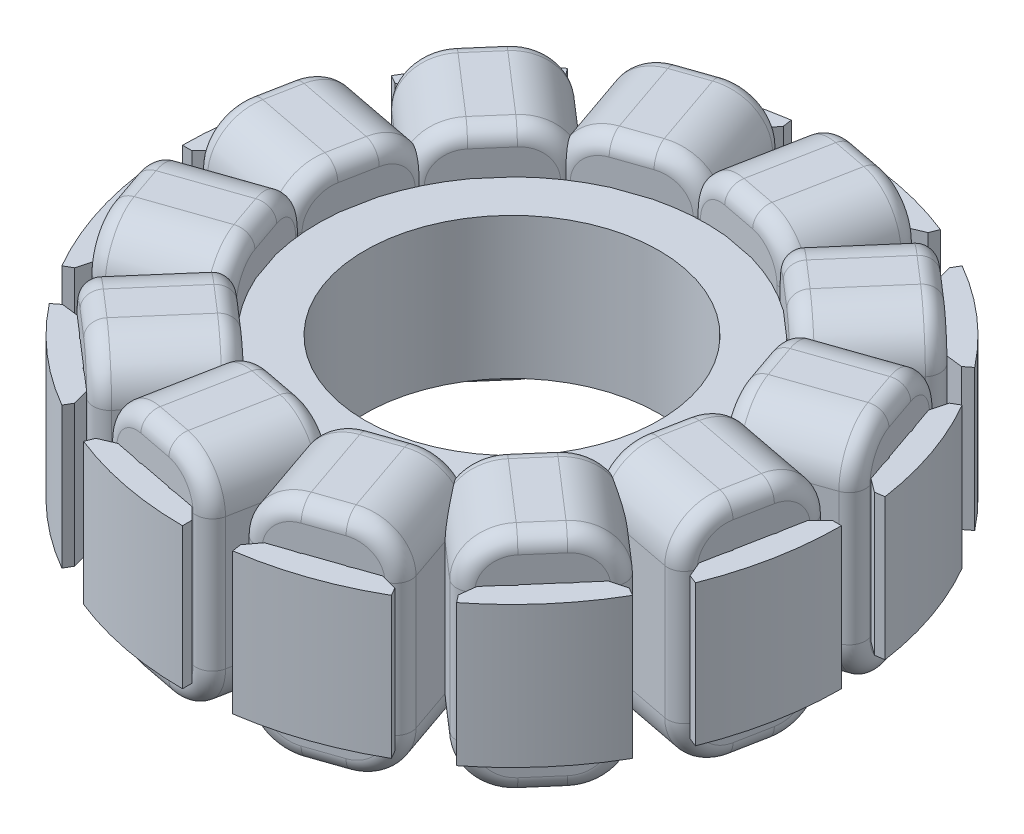
from build123d import *

# Parameters (mm, degrees)
SKETCH_1_R               = 6.25
EXTRUDE_1_DEPTH          = 6
CHAMFER_1_SIZE           = 0.6
EXTRUDE_2_DEPTH          = 7.8
EXTRUDE_2_DEPTH_BACK     = 1.8
FILLET_1_R               = 2
FILLET_2_R               = 0.7
PATTERN_CIRCULAR_1_COUNT = 12


with BuildPart() as part:
    # Эскиз1 → Бобышка-Вытянуть1 (new body)
    with BuildSketch(Plane(origin=(0, 0, 0), x_dir=(1, 0, 0), z_dir=(0, 1, 0))):
        with BuildLine():
            Line((0.818857221, 8.209261407), (1.720422101, 12.885656669))
            ThreePointArc((1.720422101, 12.885656669), (0.862108839, 12.971382669), (0, 13))
            Line((0, 13), (0, 14))
            ThreePointArc((0, 14), (2.65, 13.746908743), (5.204186881, 12.996785714))
            Line((5.204186881, 12.996785714), (4.832459247, 12.068443878))
            ThreePointArc((4.832459247, 12.068443878), (4.021727515, 12.362269525), (3.193299718, 12.601699763))
            Line((3.193299718, 12.601699763), (2.291734839, 7.925304501))
            ThreePointArc((2.291734839, 7.925304501), (3.605195483, 7.420583907), (4.813781859, 6.700000314))
            Line((4.813781859, 6.700000314), (7.932757579, 10.299094969))
            ThreePointArc((7.932757579, 10.299094969), (7.23229949, 10.802492494), (6.5, 11.258330249))
            Line((6.5, 11.258330249), (7, 12.124355653))
            ThreePointArc((7, 12.124355653), (9.168421692, 10.580172195), (11.005350903, 8.653453155))
            Line((11.005350903, 8.653453155), (10.219254409, 8.035349359))
            ThreePointArc((10.219254409, 8.035349359), (9.664052957, 8.695175699), (9.066328559, 9.316742266))
            Line((9.066328559, 9.316742266), (5.947352839, 5.717647611))
            ThreePointArc((5.947352839, 5.717647611), (6.832482828, 4.623816433), (7.518857536, 3.395479548))
            Line((7.518857536, 3.395479548), (12.01951707, 4.95289909))
            ThreePointArc((12.01951707, 4.95289909), (11.664601333, 5.739083179), (11.258330249, 6.5))
            Line((11.258330249, 6.5), (12.124355653, 7))
            ThreePointArc((12.124355653, 7), (13.230172195, 4.578487052), (13.857640037, 1.991434812))
            Line((13.857640037, 1.991434812), (12.867808606, 1.849189468))
            ThreePointArc((12.867808606, 1.849189468), (12.716903214, 2.698216568), (12.510041984, 3.535371204))
            Line((12.510041984, 3.535371204), (8.00938245, 1.977951661))
            ThreePointArc((8.00938245, 1.977951661), (8.229011916, 0.588101079), (8.209261407, -0.818857221))
            Line((8.209261407, -0.818857221), (12.885656669, -1.720422101))
            ThreePointArc((12.885656669, -1.720422101), (12.971382669, -0.862108839), (13, 0))
            Line((13, 0), (14, 0))
            ThreePointArc((14, 0), (13.746908743, -2.65), (12.996785714, -5.204186881))
            Line((12.996785714, -5.204186881), (12.068443878, -4.832459247))
            ThreePointArc((12.068443878, -4.832459247), (12.362269525, -4.021727515), (12.601699763, -3.193299718))
            Line((12.601699763, -3.193299718), (7.925304501, -2.291734839))
            ThreePointArc((7.925304501, -2.291734839), (7.420583907, -3.605195483), (6.700000314, -4.813781859))
            Line((6.700000314, -4.813781859), (10.299094969, -7.932757579))
            ThreePointArc((10.299094969, -7.932757579), (10.802492494, -7.23229949), (11.258330249, -6.5))
            Line((11.258330249, -6.5), (12.124355653, -7))
            ThreePointArc((12.124355653, -7), (10.580172195, -9.168421692), (8.653453155, -11.005350903))
            Line((8.653453155, -11.005350903), (8.035349359, -10.219254409))
            ThreePointArc((8.035349359, -10.219254409), (8.695175699, -9.664052957), (9.316742266, -9.066328559))
            Line((9.316742266, -9.066328559), (5.717647611, -5.947352839))
            ThreePointArc((5.717647611, -5.947352839), (4.623816433, -6.832482828), (3.395479548, -7.518857536))
            Line((3.395479548, -7.518857536), (4.95289909, -12.01951707))
            ThreePointArc((4.95289909, -12.01951707), (5.739083179, -11.664601333), (6.5, -11.258330249))
            Line((6.5, -11.258330249), (7, -12.124355653))
            ThreePointArc((7, -12.124355653), (4.578487052, -13.230172195), (1.991434812, -13.857640037))
            Line((1.991434812, -13.857640037), (1.849189468, -12.867808606))
            ThreePointArc((1.849189468, -12.867808606), (2.698216568, -12.716903214), (3.535371204, -12.510041984))
            Line((3.535371204, -12.510041984), (1.977951661, -8.00938245))
            ThreePointArc((1.977951661, -8.00938245), (0.588101079, -8.229011916), (-0.818857221, -8.209261407))
            Line((-0.818857221, -8.209261407), (-1.720422101, -12.885656669))
            ThreePointArc((-1.720422101, -12.885656669), (-0.862108839, -12.971382669), (0, -13))
            Line((0, -13), (0, -14))
            ThreePointArc((0, -14), (-2.65, -13.746908743), (-5.204186881, -12.996785714))
            Line((-5.204186881, -12.996785714), (-4.832459247, -12.068443878))
            ThreePointArc((-4.832459247, -12.068443878), (-4.021727515, -12.362269525), (-3.193299718, -12.601699763))
            Line((-3.193299718, -12.601699763), (-2.291734839, -7.925304501))
            ThreePointArc((-2.291734839, -7.925304501), (-3.605195483, -7.420583907), (-4.813781859, -6.700000314))
            Line((-4.813781859, -6.700000314), (-7.932757579, -10.299094969))
            ThreePointArc((-7.932757579, -10.299094969), (-7.23229949, -10.802492494), (-6.5, -11.258330249))
            Line((-6.5, -11.258330249), (-7, -12.124355653))
            ThreePointArc((-7, -12.124355653), (-9.168421692, -10.580172195), (-11.005350903, -8.653453155))
            Line((-11.005350903, -8.653453155), (-10.219254409, -8.035349359))
            ThreePointArc((-10.219254409, -8.035349359), (-9.664052957, -8.695175699), (-9.066328559, -9.316742266))
            Line((-9.066328559, -9.316742266), (-5.947352839, -5.717647611))
            ThreePointArc((-5.947352839, -5.717647611), (-6.832482828, -4.623816433), (-7.518857536, -3.395479548))
            Line((-7.518857536, -3.395479548), (-12.01951707, -4.95289909))
            ThreePointArc((-12.01951707, -4.95289909), (-11.664601333, -5.739083179), (-11.258330249, -6.5))
            Line((-11.258330249, -6.5), (-12.124355653, -7))
            ThreePointArc((-12.124355653, -7), (-13.230172195, -4.578487052), (-13.857640037, -1.991434812))
            Line((-13.857640037, -1.991434812), (-12.867808606, -1.849189468))
            ThreePointArc((-12.867808606, -1.849189468), (-12.716903214, -2.698216568), (-12.510041984, -3.535371204))
            Line((-12.510041984, -3.535371204), (-8.00938245, -1.977951661))
            ThreePointArc((-8.00938245, -1.977951661), (-8.229011916, -0.588101079), (-8.209261407, 0.818857221))
            Line((-8.209261407, 0.818857221), (-12.885656669, 1.720422101))
            ThreePointArc((-12.885656669, 1.720422101), (-12.971382669, 0.862108839), (-13, 0))
            Line((-13, 0), (-14, 0))
            ThreePointArc((-14, 0), (-13.746908743, 2.65), (-12.996785714, 5.204186881))
            Line((-12.996785714, 5.204186881), (-12.068443878, 4.832459247))
            ThreePointArc((-12.068443878, 4.832459247), (-12.362269525, 4.021727515), (-12.601699763, 3.193299718))
            Line((-12.601699763, 3.193299718), (-7.925304501, 2.291734839))
            ThreePointArc((-7.925304501, 2.291734839), (-7.420583907, 3.605195483), (-6.700000314, 4.813781859))
            Line((-6.700000314, 4.813781859), (-10.299094969, 7.932757579))
            ThreePointArc((-10.299094969, 7.932757579), (-10.802492494, 7.23229949), (-11.258330249, 6.5))
            Line((-11.258330249, 6.5), (-12.124355653, 7))
            ThreePointArc((-12.124355653, 7), (-10.580172195, 9.168421692), (-8.653453155, 11.005350903))
            Line((-8.653453155, 11.005350903), (-8.035349359, 10.219254409))
            ThreePointArc((-8.035349359, 10.219254409), (-8.695175699, 9.664052957), (-9.316742266, 9.066328559))
            Line((-9.316742266, 9.066328559), (-5.717647611, 5.947352839))
            ThreePointArc((-5.717647611, 5.947352839), (-4.623816433, 6.832482828), (-3.395479548, 7.518857536))
            Line((-3.395479548, 7.518857536), (-4.95289909, 12.01951707))
            ThreePointArc((-4.95289909, 12.01951707), (-5.739083179, 11.664601333), (-6.5, 11.258330249))
            Line((-6.5, 11.258330249), (-7, 12.124355653))
            ThreePointArc((-7, 12.124355653), (-4.578487052, 13.230172195), (-1.991434812, 13.857640037))
            Line((-1.991434812, 13.857640037), (-1.849189468, 12.867808606))
            ThreePointArc((-1.849189468, 12.867808606), (-2.698216568, 12.716903214), (-3.535371204, 12.510041984))
            Line((-3.535371204, 12.510041984), (-1.977951661, 8.00938245))
            ThreePointArc((-1.977951661, 8.00938245), (-0.588101079, 8.229011916), (0.818857221, 8.209261407))
        make_face()
        with Locations(Location((0, 0, 0), (0, 0, 270))):
            Circle(SKETCH_1_R, mode=Mode.SUBTRACT)
    extrude(amount=EXTRUDE_1_DEPTH)

    # Фаска1
    # the kernel refuses this chamfer: 0.6 mm, written as the material it takes off along each edge
    with BuildSketch(Plane(origin=(4.832459247, -1.580722619, -12.068443878), x_dir=(0.3717276343884804, 0, -0.9283418367346934), z_dir=(0, 1, 0)), Plane(origin=(10.219254409, -1.580722619, -8.035349359), x_dir=(0.7860964930364651, 0, -0.6181037968139096), z_dir=(0, 1, 0)), Plane(origin=(12.867808606, -1.580722619, -1.849189468), x_dir=(0.9898314312023908, 0, -0.14224534369822772), z_dir=(0, 1, 0)), Plane(origin=(12.068443878, -1.580722619, 4.832459247), x_dir=(0.9283418367346925, 0, 0.371727634388483), z_dir=(0, 1, 0)), Plane(origin=(8.035349359, -1.580722619, 10.219254409), x_dir=(0.6181037968139109, 0, 0.7860964930364639), z_dir=(0, 1, 0)), Plane(origin=(1.849189468, -1.580722619, 12.867808606), x_dir=(0.14224534369822298, 0, 0.9898314312023914), z_dir=(0, 1, 0)), Plane(origin=(-4.832459247, -1.580722619, 12.068443878), x_dir=(-0.3717276343884881, 0, 0.9283418367346905), z_dir=(0, 1, 0)), Plane(origin=(-10.219254409, -1.580722619, 8.035349359), x_dir=(-0.7860964930364681, 0, 0.6181037968139059), z_dir=(0, 1, 0)), Plane(origin=(-12.867808606, -1.580722619, 1.849189468), x_dir=(-0.9898314312023919, 0, 0.14224534369821973), z_dir=(0, 1, 0)), Plane(origin=(-12.068443878, -1.580722619, -4.832459247), x_dir=(-0.9283418367346894, 0, -0.3717276343884903), z_dir=(0, 1, 0)), Plane(origin=(-8.035349359, -1.580722619, -10.219254409), x_dir=(-0.6181037968139026, 0, -0.7860964930364706), z_dir=(0, 1, 0)), Plane(origin=(-1.849189468, -1.580722619, -12.867808606), x_dir=(-0.14224534369821604, 0, -0.9898314312023923), z_dir=(0, 1, 0))) as chamfer_1_piece_1:
        with BuildLine():
            Line((CHAMFER_1_SIZE, 0), (-0.014533162, 0.614533162))
            ThreePointArc((-0.014533162, 0.614533162), (-0.003842192, 0.316041483), (0, 0))
            Line((0, 0), (CHAMFER_1_SIZE, 0))
        make_face()
    extrude(amount=9.161445237, mode=Mode.SUBTRACT)
    with BuildSketch(Plane(origin=(6.5, -1.580722619, -11.258330249), x_dir=(0.8539620800625151, 0, 0.5203352436797861), z_dir=(0, 1, 0)), Plane(origin=(11.258330249, -1.580722619, -6.5), x_dir=(0.47938523336284267, 0, 0.8776045795423203), z_dir=(0, 1, 0)), Plane(origin=(13, -1.580722619, 0), x_dir=(-0.023642499479807594, 0, 0.9997204770426318), z_dir=(0, 1, 0)), Plane(origin=(11.258330249, -1.580722619, 6.5), x_dir=(-0.5203352436797923, 0, 0.8539620800625114), z_dir=(0, 1, 0)), Plane(origin=(6.5, -1.580722619, 11.258330249), x_dir=(-0.8776045795423218, 0, 0.47938523336284006), z_dir=(0, 1, 0)), Plane(origin=(0, -1.580722619, 13), x_dir=(-0.9997204770426318, 0, -0.023642499479811157), z_dir=(0, 1, 0)), Plane(origin=(-6.5, -1.580722619, 11.258330249), x_dir=(-0.8539620800625151, 0, -0.5203352436797865), z_dir=(0, 1, 0)), Plane(origin=(-11.258330249, -1.580722619, 6.5), x_dir=(-0.47938523336283173, 0, -0.8776045795423263), z_dir=(0, 1, 0)), Plane(origin=(-13, -1.580722619, 0), x_dir=(0.023642499479816004, 0, -0.9997204770426316), z_dir=(0, 1, 0)), Plane(origin=(-11.258330249, -1.580722619, -6.5), x_dir=(0.5203352436797956, 0, -0.8539620800625094), z_dir=(0, 1, 0)), Plane(origin=(-6.5, -1.580722619, -11.258330249), x_dir=(0.8776045795423236, 0, -0.47938523336283684), z_dir=(0, 1, 0)), Plane(origin=(0, -1.580722619, -13), x_dir=(0.9997204770426319, 0, 0.023642499479804346), z_dir=(0, 1, 0))) as chamfer_1_piece_2:
        with BuildLine():
            Line((0.614704986, 0), (-CHAMFER_1_SIZE * 0.0236424994798, CHAMFER_1_SIZE * 0.999720477043))
            Line((-CHAMFER_1_SIZE * 0.0236424994798, CHAMFER_1_SIZE * 0.999720477043), (0, 0))
            ThreePointArc((0, 0), (0.316043981, 0.003630893), (0.614704986, 0))
        make_face()
    extrude(amount=9.161445237, mode=Mode.SUBTRACT)


with BuildPart() as body_2:
    # Эскиз2 → Бобышка-Вытянуть2 (new, two sides: drawn at the far end of the back side and taken through both)
    with BuildSketch(Plane(origin=(0, 0, 0), x_dir=(1, 0, 0), z_dir=(0, 1, 0)).offset(-EXTRUDE_2_DEPTH_BACK)):
        Polygon((-8.01587768, 3.307617408), (-11.590123496, 6.405059122), (-7.988163585, 10.561486049), (-4.413917769, 7.464044335), align=None)
    extrude(amount=EXTRUDE_2_DEPTH + EXTRUDE_2_DEPTH_BACK)

    # Скругление1
    fillet_1_edges = [body_2.edges().sort_by_distance(p)[0] for p in [
        (-6.201040677, 7.8, -9.012765192),
        (-9.803000588, 7.8, -4.856338265),
        (-9.803000588, -1.8, -4.856338265),
        (-6.201040677, -1.8, -9.012765192),
    ]]
    fillet(fillet_1_edges, radius=FILLET_1_R)

    # Скругление2
    fillet_2_edges = [body_2.edges().sort_by_distance(p)[0] for p in [
        (-6.214897724, 7.8, -5.385830872),
        (-9.78914354, 7.8, -8.483272586),
        (-4.413917769, 3, -7.464044335),
        (-8.01587768, 3, -3.307617408),
        (-6.214897724, -1.8, -5.385830872),
        (-7.632245087, -1.214213562, -3.750304413),
        (-4.797550362, -1.214213562, -7.021357331),
        (-4.797550362, 7.214213562, -7.021357331),
        (-7.632245087, 7.214213562, -3.750304413),
        (-11.590123496, 3, -6.405059122),
        (-7.988163585, 3, -10.561486049),
        (-9.78914354, -1.8, -8.483272586),
        (-11.206490903, -1.214213562, -6.847746126),
        (-8.371796178, -1.214213562, -10.118799045),
        (-8.371796178, 7.214213562, -10.118799045),
        (-11.206490903, 7.214213562, -6.847746126),
    ]]
    fillet(fillet_2_edges, radius=FILLET_2_R)


with BuildPart() as pattern_circular_1_1:
    # Круговой массив1: pattern copy
    add(body_2.part.rotate(Axis((0, 0, 0), (0, 1, 0)), 1 * 360 / PATTERN_CIRCULAR_1_COUNT))


with BuildPart() as pattern_circular_1_2:
    # Круговой массив1: pattern copy
    add(body_2.part.rotate(Axis((0, 0, 0), (0, 1, 0)), 2 * 360 / PATTERN_CIRCULAR_1_COUNT))


with BuildPart() as pattern_circular_1_3:
    # Круговой массив1: pattern copy
    add(body_2.part.rotate(Axis((0, 0, 0), (0, 1, 0)), 3 * 360 / PATTERN_CIRCULAR_1_COUNT))


with BuildPart() as pattern_circular_1_4:
    # Круговой массив1: pattern copy
    add(body_2.part.rotate(Axis((0, 0, 0), (0, 1, 0)), 4 * 360 / PATTERN_CIRCULAR_1_COUNT))


with BuildPart() as pattern_circular_1_5:
    # Круговой массив1: pattern copy
    add(body_2.part.rotate(Axis((0, 0, 0), (0, 1, 0)), 5 * 360 / PATTERN_CIRCULAR_1_COUNT))


with BuildPart() as pattern_circular_1_6:
    # Круговой массив1: pattern copy
    add(body_2.part.rotate(Axis((0, 0, 0), (0, 1, 0)), 6 * 360 / PATTERN_CIRCULAR_1_COUNT))


with BuildPart() as pattern_circular_1_7:
    # Круговой массив1: pattern copy
    add(body_2.part.rotate(Axis((0, 0, 0), (0, 1, 0)), 7 * 360 / PATTERN_CIRCULAR_1_COUNT))


with BuildPart() as pattern_circular_1_8:
    # Круговой массив1: pattern copy
    add(body_2.part.rotate(Axis((0, 0, 0), (0, 1, 0)), 8 * 360 / PATTERN_CIRCULAR_1_COUNT))


with BuildPart() as pattern_circular_1_9:
    # Круговой массив1: pattern copy
    add(body_2.part.rotate(Axis((0, 0, 0), (0, 1, 0)), 9 * 360 / PATTERN_CIRCULAR_1_COUNT))


with BuildPart() as pattern_circular_1_10:
    # Круговой массив1: pattern copy
    add(body_2.part.rotate(Axis((0, 0, 0), (0, 1, 0)), 10 * 360 / PATTERN_CIRCULAR_1_COUNT))


with BuildPart() as pattern_circular_1_11:
    # Круговой массив1: pattern copy
    add(body_2.part.rotate(Axis((0, 0, 0), (0, 1, 0)), 11 * 360 / PATTERN_CIRCULAR_1_COUNT))


solid = Compound([part.part, body_2.part, pattern_circular_1_1.part, pattern_circular_1_2.part, pattern_circular_1_3.part, pattern_circular_1_4.part, pattern_circular_1_5.part, pattern_circular_1_6.part, pattern_circular_1_7.part, pattern_circular_1_8.part, pattern_circular_1_9.part, pattern_circular_1_10.part, pattern_circular_1_11.part])
